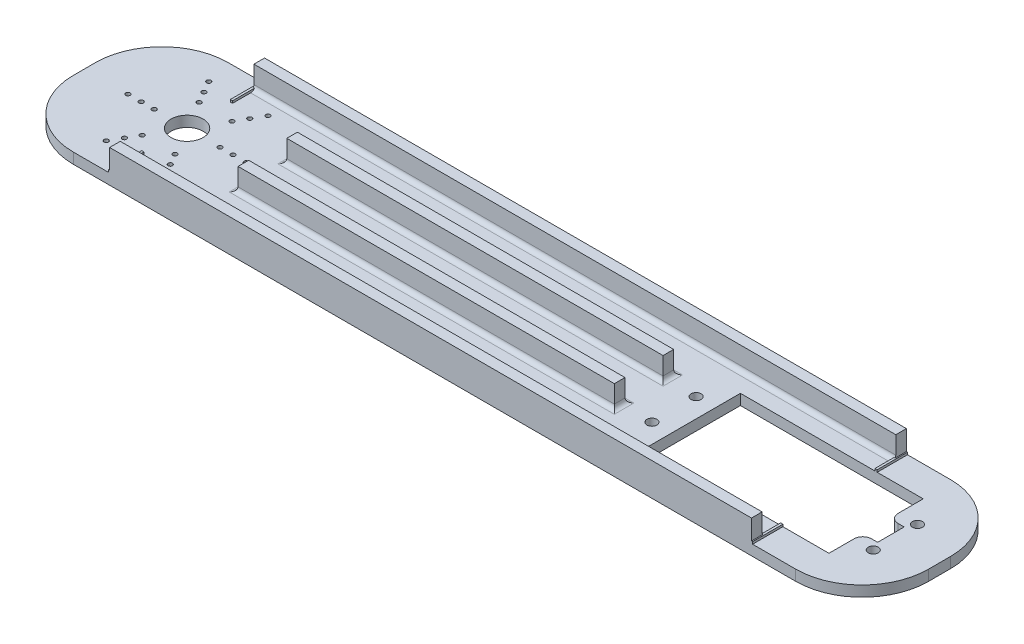
from build123d import *

# Parameters (mm, degrees)
SKETCH1_W               = 193.2
SKETCH1_H               = 35
BOSS_EXTRUDE1_DEPTH     = 2.4
SKETCH2_R               = 1.13
SKETCH2_R_2             = 3.625
SKETCH2_R_3             = 0.5
SKETCH2_W               = 40
SKETCH2_H               = 20
CUT_EXTRUDE1_DEPTH      = 2.4
SKETCH4_W               = 4
SKETCH4_H               = 6
CUT_EXTRUDE2_DEPTH      = 2.4
FILLET1_R               = 15
SKETCH5_W               = 0.5
SKETCH5_H               = 7.5
BOSS_EXTRUDE2_DEPTH     = 0.5
CUT_EXTRUDE3_DEPTH      = 134.373649476
CUT_EXTRUDE3_DEPTH_BACK = 134.373649476
SKETCH7_W               = 41.3
SKETCH7_H               = 21.3
SKETCH7_W_2             = 40
SKETCH7_H_2             = 20
SKETCH8_W               = 145
SKETCH8_H               = 2.4
SKETCH8_W_2             = 85
BOSS_EXTRUDE3_DEPTH     = 5
FILLET2_R               = 2
FILLET3_R               = 1


with BuildPart() as part:
    # Sketch1 → Boss-Extrude1 (new body)
    with BuildSketch(Plane(origin=(0, 0, 0), x_dir=(1, 0, 0), z_dir=(0, 1, 0))):
        with Locations((30.922946176, 21.495750708)):
            Rectangle(SKETCH1_W, SKETCH1_H)
    extrude(amount=BOSS_EXTRUDE1_DEPTH)

    # Sketch2 → Cut-Extrude1 (cut)
    with BuildSketch(Plane(origin=(0, 2.4, 0), x_dir=(1, 0, 0), z_dir=(0, 1, 0))):
        with Locations((67.522946176, 26.495750708)):
            Circle(SKETCH2_R)
        with Locations((117.522946176, 26.495750708)):
            Circle(SKETCH2_R)
        with Locations((117.522946176, 16.495750708)):
            Circle(SKETCH2_R)
        with Locations((67.522946176, 16.495750708)):
            Circle(SKETCH2_R)
        with Locations((-42.477053824, 21.495750708)):
            Circle(SKETCH2_R_2)
        with Locations((-49.907053824, 21.495750708)):
            Circle(SKETCH2_R_3)
        with Locations((-52.842053824, 21.495750708)):
            Circle(SKETCH2_R_3)
        with Locations((-55.847053824, 21.495750708)):
            Circle(SKETCH2_R_3)
        with Locations((-49.162053824, 33.074510357)):
            Circle(SKETCH2_R_3)
        with Locations((-47.659553824, 30.472104018)):
            Circle(SKETCH2_R_3)
        with Locations((-46.192053824, 27.930319458)):
            Circle(SKETCH2_R_3)
        with Locations((-35.792053824, 33.074510357)):
            Circle(SKETCH2_R_3)
        with Locations((-37.294553824, 30.472104018)):
            Circle(SKETCH2_R_3)
        with Locations((-38.762053824, 27.930319458)):
            Circle(SKETCH2_R_3)
        with Locations((-29.107053824, 21.495750708)):
            Circle(SKETCH2_R_3)
        with Locations((-32.112053824, 21.495750708)):
            Circle(SKETCH2_R_3)
        with Locations((-35.047053824, 21.495750708)):
            Circle(SKETCH2_R_3)
        with Locations((-35.792053824, 9.91699106)):
            Circle(SKETCH2_R_3)
        with Locations((-37.294553824, 12.519397398)):
            Circle(SKETCH2_R_3)
        with Locations((-38.762053824, 15.061181958)):
            Circle(SKETCH2_R_3)
        with Locations((-49.162053824, 9.91699106)):
            Circle(SKETCH2_R_3)
        with Locations((-47.659553824, 12.519397398)):
            Circle(SKETCH2_R_3)
        with Locations((-46.192053824, 15.061181958)):
            Circle(SKETCH2_R_3)
        with Locations((92.522946176, 21.495750708)):
            Rectangle(SKETCH2_W, SKETCH2_H)
    extrude(amount=-CUT_EXTRUDE1_DEPTH, mode=Mode.SUBTRACT)

    # Sketch4 → Cut-Extrude2 (cut)
    with BuildSketch(Plane(origin=(0, 2.4, 0), x_dir=(1, 0, 0), z_dir=(0, 1, 0))):
        with Locations((114.522946176, 21.495750708)):
            Rectangle(SKETCH4_W, SKETCH4_H)
    extrude(amount=-CUT_EXTRUDE2_DEPTH, mode=Mode.SUBTRACT)

    # Fillet1
    fillet1_edges = [part.edges().sort_by_distance(p)[0] for p in [
        (127.522946176, 1.2, -38.995750708),
        (127.522946176, 1.2, -3.995750708),
        (-65.677053824, 1.2, -3.995750708),
        (-65.677053824, 1.2, -38.995750708),
    ]]
    fillet(fillet1_edges, radius=FILLET1_R)

    # Sketch5 → Boss-Extrude2 (add)
    with BuildSketch(Plane(origin=(0, 2.4, 0), x_dir=(1, 0, 0), z_dir=(0, 1, 0))):
        with Locations((102.522946176, 35.245750708)):
            Rectangle(SKETCH5_W, SKETCH5_H)
        with Locations((102.522946176, 7.745750708)):
            Rectangle(SKETCH5_W, SKETCH5_H)
        with Locations((-42.477053824, 7.745750708)):
            Rectangle(SKETCH5_W, SKETCH5_H)
        with Locations((-42.477053824, 35.245750708)):
            Rectangle(SKETCH5_W, SKETCH5_H)
    extrude(amount=BOSS_EXTRUDE2_DEPTH)

    # Sketch7 → Cut-Extrude3 (cut, two sides: drawn at the far end of the back side and taken through both)
    with BuildSketch(Plane(origin=(0, 2.4, 0), x_dir=(1, 0, 0), z_dir=(0, 1, 0)).offset(-CUT_EXTRUDE3_DEPTH_BACK)):
        with Locations((92.522946176, 21.495750708)):
            Rectangle(SKETCH7_W, SKETCH7_H)
        with Locations((92.522946176, 21.495750708)):
            Rectangle(SKETCH7_W_2, SKETCH7_H_2, mode=Mode.SUBTRACT)
    extrude(amount=CUT_EXTRUDE3_DEPTH + CUT_EXTRUDE3_DEPTH_BACK, mode=Mode.SUBTRACT)

    # Sketch8 → Boss-Extrude3 (add)
    with BuildSketch(Plane(origin=(0, 2.4, 0), x_dir=(1, 0, 0), z_dir=(0, 1, 0))):
        with Locations((30.022946176, 37.795750708)):
            Rectangle(SKETCH8_W, SKETCH8_H)
        with Locations((18.243410163, 26.995750708)):
            Rectangle(SKETCH8_W_2, SKETCH8_H)
        with Locations((18.243410163, 15.995750708)):
            Rectangle(SKETCH8_W_2, SKETCH8_H)
        with Locations((30.022946176, 5.195750708)):
            Rectangle(SKETCH8_W, SKETCH8_H)
    extrude(amount=BOSS_EXTRUDE3_DEPTH)

    # Fillet2
    fillet2_edges = [part.edges().sort_by_distance(p)[0] for p in [
        (113.172946176, 1.2, -18.495750708),
        (113.172946176, 1.2, -24.495750708),
    ]]
    fillet(fillet2_edges, radius=FILLET2_R)

    # Fillet3
    fillet3_edges = [part.edges().sort_by_distance(p)[0] for p in [
        (18.243410163, 2.4, -28.195750708),
        (18.243410163, 2.4, -17.195750708),
        (30.022946176, 2.4, -6.395750708),
        (60.743410163, 2.4, -15.995750708),
        (60.743410163, 2.4, -26.995750708),
        (-24.256589837, 2.4, -26.995750708),
        (-24.256589837, 2.4, -15.995750708),
        (18.243410163, 2.4, -14.795750708),
        (18.243410163, 2.4, -25.795750708),
        (30.022946176, 2.4, -36.595750708),
    ]]
    fillet(fillet3_edges, radius=FILLET3_R)


solid = part.part
